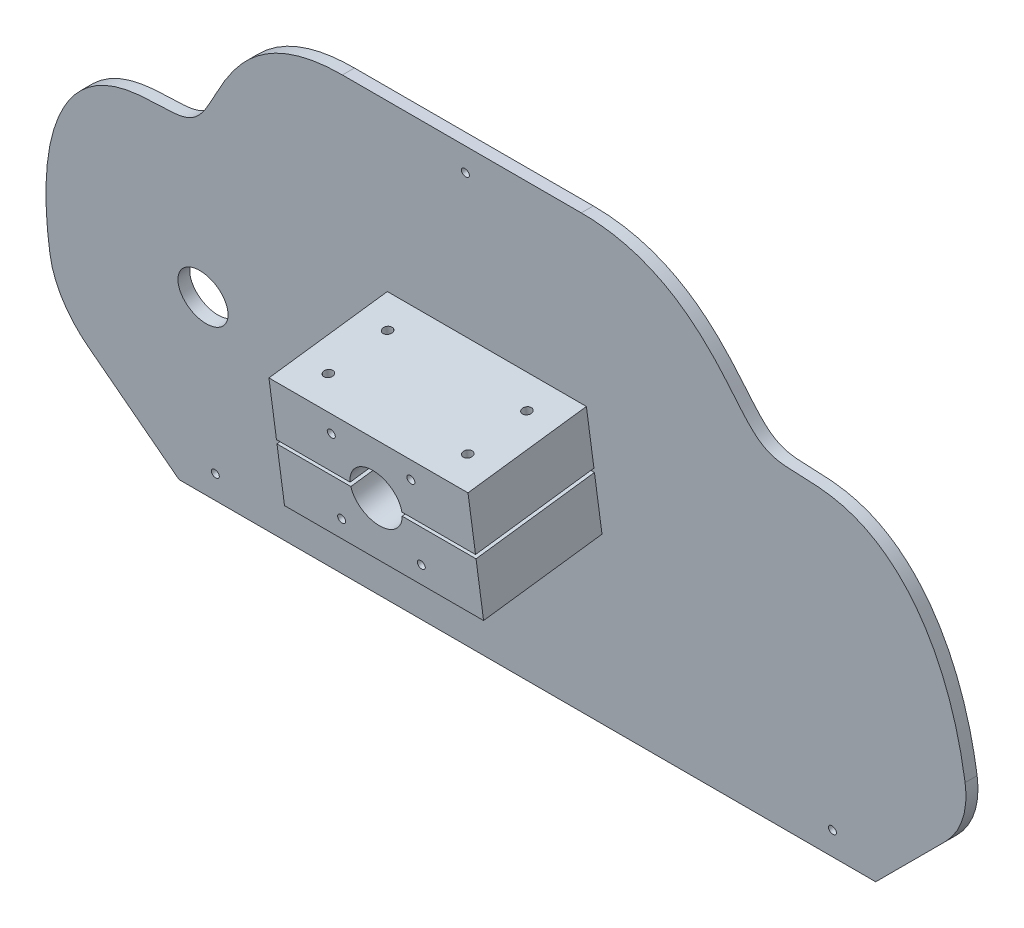
from build123d import *

# Parameters (mm, degrees)
EXTRUDE_START                          = -25
EXTRUDE_PLATE_SHAPE_DEPTH              = 50
CUT_EXTRUDE_ANGLE_DEPTH                = 341.53226913
CUT_EXTRUDE_ANGLE_DEPTH_BACK           = 341.53226913
EXTRUDE_SUPPORT_BLOCK_DEPTH            = 50
CUT_EXTRUDE_SHAFT_HOLE_DEPTH           = 349.426376391
CUT_EXTRUDE_SHAFT_HOLE_DEPTH_BACK      = 349.426376391
STEERING_WHEEL_SHAFT_HOLE_R            = 12.75
CUT_EXTRUDE_SWITCH_HOLE_DEPTH          = 349.426376391
CUT_EXTRUDE_SWITCH_HOLE_DEPTH_BACK     = 349.426376391
IGNITION_SWITCH_HOLE_R                 = 12.5
STEERING_WHEEL_RELIEF_HOLE_R           = 13
CUT_EXTRUDE_RELIEF_HOLE_DEPTH          = 60
CUT_EXTRUDE_SLOT_REACH                 = 383.093
CUT_EXTRUDE_BOLT_HOLES_REACH           = 281.842
PRESSURE_BOLT_HOLES_R                  = 2.25
ENCODER_PCB_MOUNT_HOLE_PATTERN_R       = 2
CUT_EXTRUDE_PCB_MOUNT_HOLES_DEPTH      = 60
CUT_EXTRUDE_ENCLOSURE_HOLES_DEPTH      = 348.572741062
CUT_EXTRUDE_ENCLOSURE_HOLES_DEPTH_BACK = 348.572741062
BOTTOM_ENCLOSURE_MOUNTING_HOLES_R      = 2
CUT_EXTRUDE13_DEPTH                    = 348.572741062
CUT_EXTRUDE13_DEPTH_BACK               = 348.572741062
SKETCH23_R                             = 2


# Read off the part's stored shape, not the designer's step: Extrude Plate Shape
with BuildPart() as part:
    # Extrude Plate Shape outline → Extrude Plate Shape (new body)
    with BuildSketch(Plane.XY.offset(EXTRUDE_START)):
        with BuildLine():
            Line((175, 0), (215.218833807, 40.218833807))
            ThreePointArc((215.218833807, 40.218833807), (226.057471223, 56.440000887), (229.863494748, 75.574172084))
            add(Edge.make_bspline(
                [(229.863494748, 75.574172084), (229.863497015, 220.574172084), (130.657195822, 208), (130.657198498, 108), (160, 250), (60, 250)],
                knots=[0, 0, 0, 0, 0, 0, 1, 1, 1, 1, 1, 1], degree=5))
            Line((60, 250), (-60, 250))
            add(Edge.make_bspline(
                [(-60, 250), (-160, 250), (-130.657198498, 108), (-130.657195822, 208), (-229.863497015, 220.574172084), (-229.863494748, 75.574172084)],
                knots=[0, 0, 0, 0, 0, 0, 1, 1, 1, 1, 1, 1], degree=5))
            ThreePointArc((-229.863494748, 75.574172084), (-226.057471223, 56.440000887), (-215.218833807, 40.218833807))
            Line((-215.218833807, 40.218833807), (-175, 0))
            Line((-175, 0), (175, 0))
        make_face()
    extrude(amount=EXTRUDE_PLATE_SHAPE_DEPTH)

    # 5-Degree Front Plate → Cut-Extrude Angle (cut, two sides: drawn at the far end of the back side and taken through both)
    with BuildSketch(Plane(origin=(0, 0, 0), x_dir=(0, 0, -1), z_dir=(1, 0, 0)).offset(-CUT_EXTRUDE_ANGLE_DEPTH_BACK)):
        Polygon((20.798974056, -10), (-14.747200293, 260), (35, 260), (35, -10), align=None)
        Polygon((-20.798974056, 260), (14.747200293, -10), (-35, -10), (-35, 260), align=None)
    extrude(amount=CUT_EXTRUDE_ANGLE_DEPTH + CUT_EXTRUDE_ANGLE_DEPTH_BACK, mode=Mode.SUBTRACT)

    # Support Block → Extrude Support Block (add, symmetric)
    with BuildSketch(Plane(origin=(0, 0, 0), x_dir=(0, 0, -1), z_dir=(1, 0, 0))):
        Polygon((-6.907883487, 154.486691682), (0.923688046, 95), (-58.563003637, 87.168428467), (-66.39457517, 146.655120149), align=None)
    extrude(amount=EXTRUDE_SUPPORT_BLOCK_DEPTH, both=True)

    # Steering Wheel Shaft Hole → Cut-Extrude Shaft Hole (cut, two sides: drawn at the far end of the back side and taken through both)
    with BuildSketch(Plane(origin=(0, 2.521214434, -19.150524903), x_dir=(-1, 0, 0), z_dir=(0, 0.13052619222005532, -0.99144486137381)).offset(-CUT_EXTRUDE_SHAFT_HOLE_DEPTH_BACK)):
        with Locations(Location((0, 124.614270251, 0), (0, 0, 90))):
            Circle(STEERING_WHEEL_SHAFT_HOLE_R)
    extrude(amount=CUT_EXTRUDE_SHAFT_HOLE_DEPTH + CUT_EXTRUDE_SHAFT_HOLE_DEPTH_BACK, mode=Mode.SUBTRACT)

    # Ignition Switch Hole → Cut-Extrude Switch Hole (cut, two sides: drawn at the far end of the back side and taken through both)
    with BuildSketch(Plane(origin=(0, 2.521214434, -19.150524903), x_dir=(-1, 0, 0), z_dir=(0, 0.13052619222005532, -0.99144486137381)).offset(-CUT_EXTRUDE_SWITCH_HOLE_DEPTH_BACK)):
        with Locations(Location((150, 97.457030106, 0), (0, 0, 90))):
            Circle(IGNITION_SWITCH_HOLE_R)
    extrude(amount=CUT_EXTRUDE_SWITCH_HOLE_DEPTH + CUT_EXTRUDE_SWITCH_HOLE_DEPTH_BACK, mode=Mode.SUBTRACT)

    # Steering Wheel Relief Hole → Cut-Extrude Relief Hole (cut)
    with BuildSketch(Plane(origin=(0, -6.093514253, 46.284835948), x_dir=(1, 0, 0), z_dir=(0, -0.13052619222005324, 0.9914448613738103))):
        with Locations(Location((0, 124.614270251, 0), (0, 0, 270))):
            Circle(STEERING_WHEEL_RELIEF_HOLE_R)
    extrude(amount=-CUT_EXTRUDE_RELIEF_HOLE_DEPTH, mode=Mode.SUBTRACT)

    # Cut-Extrude Slot: up to this face of the body (flat: up to its plane)
    cut_extrude_slot_end = Plane(part.part.faces().sort_by_distance((50, 120.827560075, 32.735443562))[0])
    # Tightening Slot → Cut-Extrude Slot (cut, up to the picked face)
    with BuildSketch(Plane.ZY.offset(50), mode=Mode.PRIVATE) as cut_extrude_slot_sk1:
        Polygon((62.609315595, 117.903219169), (62.348263211, 115.920329447), (2.861571529, 123.75190098), (3.122623913, 125.734790703), align=None)
    cut_extrude_slot_tool1 = split(extrude(cut_extrude_slot_sk1.sketch, amount=-CUT_EXTRUDE_SLOT_REACH, mode=Mode.PRIVATE), bisect_by=cut_extrude_slot_end, keep=Keep.BOTH, mode=Mode.PRIVATE)
    add(cut_extrude_slot_tool1.solids().sort_by(Axis((-50, 120.82756, 32.735444), (1, 0, 0)))[0], mode=Mode.SUBTRACT)

    # Cut-Extrude Bolt Holes: up to this face of the body (flat: up to its plane)
    cut_extrude_bolt_holes_end = Plane(part.part.faces().sort_by_distance((0, 91.084214233, 28.819657795))[0])
    # Pressure Bolt Holes → Cut-Extrude Bolt Holes (cut, up to the picked face)
    with BuildSketch(Plane(origin=(0, 152.748634402, 20.109739222), x_dir=(1, 0, 0), z_dir=(0, 0.99144486137381, 0.13052619222005454)), mode=Mode.PRIVATE) as cut_extrude_bolt_holes_sk1:
        with Locations(Location((-35, -1.684225972, 0), (0, 0, 270))):
            Circle(PRESSURE_BOLT_HOLES_R)
    cut_extrude_bolt_holes_tool1 = split(extrude(cut_extrude_bolt_holes_sk1.sketch, amount=-CUT_EXTRUDE_BOLT_HOLES_REACH, mode=Mode.PRIVATE), bisect_by=cut_extrude_bolt_holes_end, keep=Keep.BOTH, mode=Mode.PRIVATE)
    # Pressure Bolt Holes → Cut-Extrude Bolt Holes (cut, up to the picked face)
    with BuildSketch(Plane(origin=(0, 152.748634402, 20.109739222), x_dir=(1, 0, 0), z_dir=(0, 0.99144486137381, 0.13052619222005454)), mode=Mode.PRIVATE) as cut_extrude_bolt_holes_sk2:
        with Locations(Location((-35, -31.684225972, 0), (0, 0, 270))):
            Circle(PRESSURE_BOLT_HOLES_R)
    cut_extrude_bolt_holes_tool2 = split(extrude(cut_extrude_bolt_holes_sk2.sketch, amount=-CUT_EXTRUDE_BOLT_HOLES_REACH, mode=Mode.PRIVATE), bisect_by=cut_extrude_bolt_holes_end, keep=Keep.BOTH, mode=Mode.PRIVATE)
    # Pressure Bolt Holes → Cut-Extrude Bolt Holes (cut, up to the picked face)
    with BuildSketch(Plane(origin=(0, 152.748634402, 20.109739222), x_dir=(1, 0, 0), z_dir=(0, 0.99144486137381, 0.13052619222005454)), mode=Mode.PRIVATE) as cut_extrude_bolt_holes_sk3:
        with Locations(Location((35, -31.684225972, 0), (0, 0, 270))):
            Circle(PRESSURE_BOLT_HOLES_R)
    cut_extrude_bolt_holes_tool3 = split(extrude(cut_extrude_bolt_holes_sk3.sketch, amount=-CUT_EXTRUDE_BOLT_HOLES_REACH, mode=Mode.PRIVATE), bisect_by=cut_extrude_bolt_holes_end, keep=Keep.BOTH, mode=Mode.PRIVATE)
    # Pressure Bolt Holes → Cut-Extrude Bolt Holes (cut, up to the picked face)
    with BuildSketch(Plane(origin=(0, 152.748634402, 20.109739222), x_dir=(1, 0, 0), z_dir=(0, 0.99144486137381, 0.13052619222005454)), mode=Mode.PRIVATE) as cut_extrude_bolt_holes_sk4:
        with Locations(Location((35, -1.684225972, 0), (0, 0, 270))):
            Circle(PRESSURE_BOLT_HOLES_R)
    cut_extrude_bolt_holes_tool4 = split(extrude(cut_extrude_bolt_holes_sk4.sketch, amount=-CUT_EXTRUDE_BOLT_HOLES_REACH, mode=Mode.PRIVATE), bisect_by=cut_extrude_bolt_holes_end, keep=Keep.BOTH, mode=Mode.PRIVATE)
    add(cut_extrude_bolt_holes_tool1.solids().sort_by(Axis((-35, 152.528799, 21.779556), (0, -0.99144486137381, -0.13052619222005454)))[0], mode=Mode.SUBTRACT)
    add(cut_extrude_bolt_holes_tool2.solids().sort_by(Axis((-35, 148.613013, 51.522902), (0, -0.99144486137381, -0.13052619222005454)))[0], mode=Mode.SUBTRACT)
    add(cut_extrude_bolt_holes_tool3.solids().sort_by(Axis((35, 148.613013, 51.522902), (0, -0.99144486137381, -0.13052619222005454)))[0], mode=Mode.SUBTRACT)
    add(cut_extrude_bolt_holes_tool4.solids().sort_by(Axis((35, 152.528799, 21.779556), (0, -0.99144486137381, -0.13052619222005454)))[0], mode=Mode.SUBTRACT)

    # Encoder PCB Mount Hole Pattern → Cut-Extrude PCB Mount Holes (cut)
    with BuildSketch(Plane(origin=(0, -6.093514253, 46.284835948), x_dir=(1, 0, 0), z_dir=(0, -0.13052619222005565, 0.9914448613738099))):
        with Locations(Location((-20, 144.066696347, 0), (0, 0, 270))):
            Circle(ENCODER_PCB_MOUNT_HOLE_PATTERN_R)
        with Locations(Location((-20, 104.066696347, 0), (0, 0, 270))):
            Circle(ENCODER_PCB_MOUNT_HOLE_PATTERN_R)
        with Locations(Location((20, 104.066696347, 0), (0, 0, 270))):
            Circle(ENCODER_PCB_MOUNT_HOLE_PATTERN_R)
        with Locations(Location((20, 144.066696347, 0), (0, 0, 270))):
            Circle(ENCODER_PCB_MOUNT_HOLE_PATTERN_R)
    extrude(amount=-CUT_EXTRUDE_PCB_MOUNT_HOLES_DEPTH, mode=Mode.SUBTRACT)

    # Bottom Enclosure Mounting Holes → Cut-Extrude Enclosure Holes (cut, two sides: drawn at the far end of the back side and taken through both)
    with BuildSketch(Plane(origin=(0, 1.73805728, -13.201855735), x_dir=(1, 0, 0), z_dir=(0, -0.13052619222005535, 0.99144486137381)).offset(-CUT_EXTRUDE_ENCLOSURE_HOLES_DEPTH_BACK)):
        with Locations(Location((155.01, 11.798718852, 0), (0, 0, 270))):
            Circle(BOTTOM_ENCLOSURE_MOUNTING_HOLES_R)
        with Locations(Location((-155.01, 11.798718852, 0), (0, 0, 270))):
            Circle(BOTTOM_ENCLOSURE_MOUNTING_HOLES_R)
    extrude(amount=CUT_EXTRUDE_ENCLOSURE_HOLES_DEPTH + CUT_EXTRUDE_ENCLOSURE_HOLES_DEPTH_BACK, mode=Mode.SUBTRACT)

    # Sketch23 → Cut-Extrude13 (cut, two sides: drawn at the far end of the back side and taken through both)
    with BuildSketch(Plane(origin=(0, 1.73805728, -13.201855735), x_dir=(1, 0, 0), z_dir=(0, -0.13052619222005535, 0.99144486137381)).offset(-CUT_EXTRUDE13_DEPTH_BACK)):
        with Locations(Location((0, 236.854185237, 0), (0, 0, 270))):
            Circle(SKETCH23_R)
    extrude(amount=CUT_EXTRUDE13_DEPTH + CUT_EXTRUDE13_DEPTH_BACK, mode=Mode.SUBTRACT)


solid = part.part
